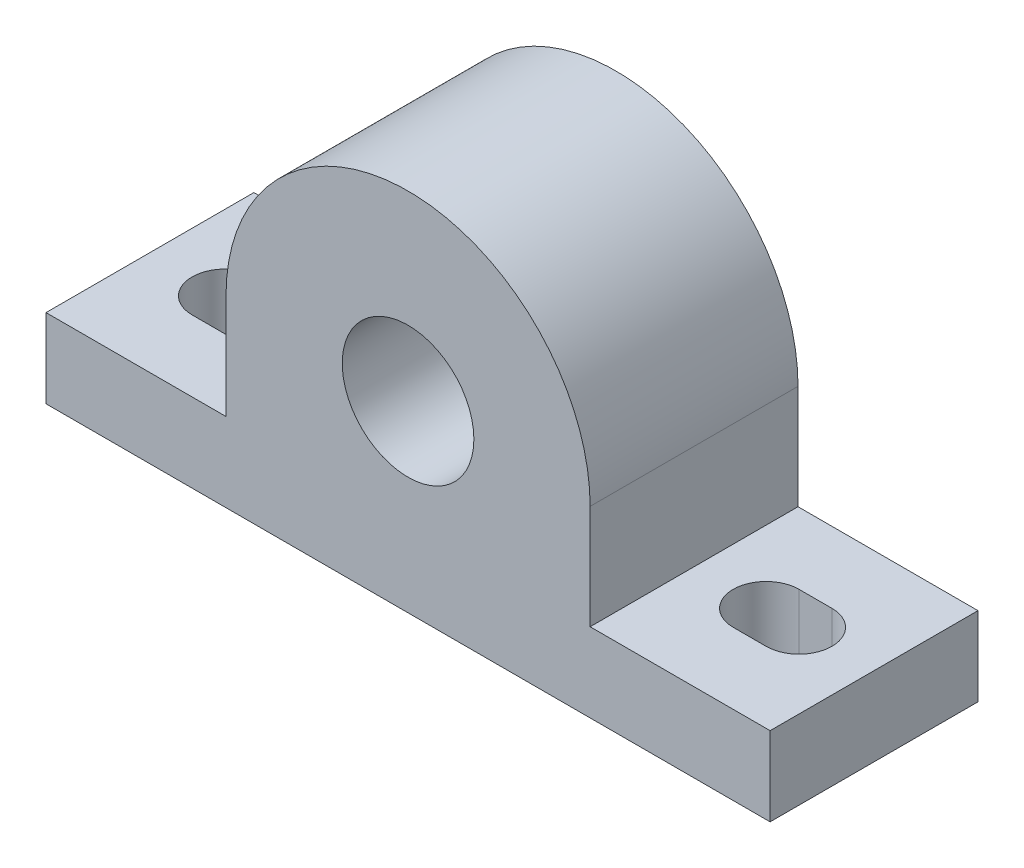
from build123d import *

# Parameters (mm, degrees)
SKETCH2_R                      = 12.7
BOSS_EXTRUDE1_DEPTH            = 40.1066
F_1_2_0_5_DIAMETER_SLOT1_DEPTH = 15.24


# Read off the part's stored shape, not the designer's step: 1/2 (0.5) Diameter Slot1
with BuildPart() as part:
    # Sketch2 → Boss-Extrude1 (new body)
    with BuildSketch(Plane.XY):
        with BuildLine():
            Line((69.85, 0), (-69.85, 0))
            Line((-69.85, 0), (-69.85, 15.24))
            Line((-69.85, 15.24), (-35.1282, 15.24))
            Line((-35.1282, 15.24), (-35.1282, 35.3568))
            ThreePointArc((-35.1282, 35.3568), (0, 70.485), (35.1282, 35.3568))
            Line((35.1282, 35.3568), (35.1282, 15.24))
            Line((35.1282, 15.24), (69.85, 15.24))
            Line((69.85, 15.24), (69.85, 0))
        make_face()
        with Locations((0, 35.3568)):
            Circle(SKETCH2_R, mode=Mode.SUBTRACT)
    extrude(amount=BOSS_EXTRUDE1_DEPTH)

    # 1/2 (0.5) Diameter Slot1 outline → 1/2 (0.5) Diameter Slot1 (cut)
    with BuildSketch(Plane(origin=(0, 0, 0), x_dir=(1, 0, 0), z_dir=(0, 1, 0))):
        with BuildLine():
            Line((-55.372, -26.4033), (-49.022, -26.4033))
            ThreePointArc((-49.022, -26.4033), (-42.672, -20.0533), (-49.022, -13.7033))
            Line((-49.022, -13.7033), (-55.372, -13.7033))
            ThreePointArc((-55.372, -13.7033), (-61.722, -20.0533), (-55.372, -26.4033))
        make_face()
        with BuildLine():
            ThreePointArc((55.372, -26.4033), (61.722, -20.0533), (55.372, -13.7033))
            Line((55.372, -13.7033), (49.022, -13.7033))
            ThreePointArc((49.022, -13.7033), (42.672, -20.0533), (49.022, -26.4033))
            Line((49.022, -26.4033), (55.372, -26.4033))
        make_face()
    extrude(amount=F_1_2_0_5_DIAMETER_SLOT1_DEPTH, mode=Mode.SUBTRACT)


solid = part.part
